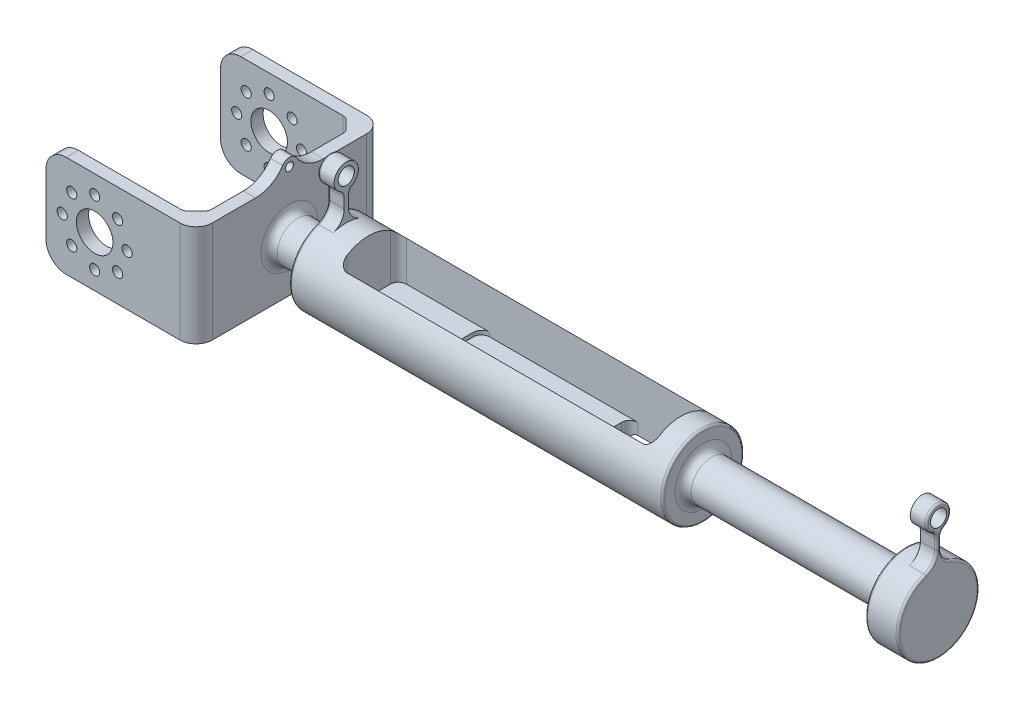
from build123d import *

# Parameters (mm, degrees)
SKETCH3_W                                           = 4
SKETCH3_H                                           = 1
BOSS_EXTRUDE1_DEPTH                                 = 75
BOSS_EXTRUDE1_DEPTH_BACK                            = 75
SKETCH2_R                                           = 10
SKETCH5_W                                           = 1
SKETCH5_H                                           = 9
EXTRUDE_THIN1_DEPTH                                 = 4
FILLET2_R                                           = 2
FILLET1_R                                           = 4
CUT_EXTRUDE1_DEPTH                                  = 80.082235679
CUT_EXTRUDE1_DEPTH_BACK                             = 4
SKETCH7_W                                           = 77
SKETCH7_H                                           = 14.7
SKETCH7_5_W                                         = 20
SKETCH7_5_H                                         = 14.7
CUT_EXTRUDE2_DEPTH                                  = 80.082235679
FILLET3_R                                           = 2
BOSS_EXTRUDE2_START                                 = -4
SKETCH7_4_W                                         = 20.5
SKETCH7_4_H                                         = 14.7
BOSS_EXTRUDE2_DEPTH                                 = 1
CBORE_FOR_00_BINDING_HEAD_MACHINE_SCREW_D           = 1.397
CBORE_FOR_00_BINDING_HEAD_MACHINE_SCREW_CBORE_D     = 3.175
CBORE_FOR_00_BINDING_HEAD_MACHINE_SCREW_CBORE_DEPTH = 2.711196
FILLET11_R                                          = 2
BOSS_EXTRUDE4_START                                 = -85
SKETCH2_2_R                                         = 5
BOSS_EXTRUDE4_DEPTH                                 = 10
SPLIT1_SURFACE_1_1_BACK                             = 165.587
SPLIT1_SURFACE_1_1_DEPTH                            = 331.174
SPLIT1_SURFACE_1_2_BACK                             = 165.587
SPLIT1_SURFACE_1_2_DEPTH                            = 331.174
SPLIT1_SURFACE_2_3_BACK                             = 165.587
SPLIT1_SURFACE_2_3_DEPTH                            = 331.174
SPLIT1_SURFACE_2_4_BACK                             = 165.587
SPLIT1_SURFACE_2_4_DEPTH                            = 331.174
MOVE_START                                          = 17
MOVE_FACE1_OUTLINE_R                                = 10
MOVE_FACE1_OUTLINE_R_2                              = 5
MOVE_FACE1_DEPTH                                    = 50
SHELL3_T                                            = -2
SKETCH12_W                                          = 40
SKETCH12_H                                          = 25
BOSS_EXTRUDE3_DEPTH                                 = 3
FILLET5_R                                           = 2
BOSS_EXTRUDE5_START                                 = -20
SKETCH14_W                                          = 37
SKETCH14_H                                          = 25
BOSS_EXTRUDE5_DEPTH                                 = 3
CUT_EXTRUDE3_DEPTH                                  = 127.261633127
CUT_EXTRUDE3_DEPTH_BACK                             = 127.261633127
SKETCH15_R                                          = 4.5
SKETCH15_R_2                                        = 1.25
FILLET6_R                                           = 4
CHAMFER1_SIZE                                       = 3
FILLET10_R                                          = 2
FILLET8_R                                           = 5
FILLET9_R                                           = 0.5
SKETCH17_W                                          = 3
SKETCH17_H                                          = 1
SKETCH18_W                                          = 2
SKETCH18_H                                          = 1.5
EXTRUDE_THIN2_DEPTH                                 = 3
FILLET12_R                                          = 8
FILLET13_R                                          = 8


# Read off the part's stored shape, not the designer's step: Move Face1
# Some blends are built 0.0001 mm under size
with BuildPart() as part:
    # Sketch3 → Revolve1 (revolve)
    with BuildSketch(Plane.XY, mode=Mode.PRIVATE) as revolve1_sk:
        with Locations((-73, 17.5)):
            Rectangle(SKETCH3_W, SKETCH3_H)
    revolve(revolve1_sk.sketch.rotate(Axis((-75, 20, 0), (1, 0, 0)), 270), axis=Axis((-75, 20, 0), (1, 0, 0)))

    # Sketch5 → Extrude-Thin1 (add)
    with BuildSketch(Plane(origin=(-75, 0, 75), x_dir=(0, 0, 1), z_dir=(-1, 0, 0))):
        with Locations((-75, 13.5)):
            Rectangle(SKETCH5_W, SKETCH5_H)
    extrude(amount=-EXTRUDE_THIN1_DEPTH)

    # Fillet2
    fillet2_edges = [part.edges().sort_by_distance(p)[0] for p in [
        (-73, 17.041960108, 0.5),
        (-73, 17.041960108, -0.5),
    ]]
    fillet(fillet2_edges, radius=FILLET2_R)


with BuildPart() as body_2:
    # Sketch2 → Boss-Extrude1 (new, two sides: drawn at the far end of the back side and taken through both)
    with BuildSketch(Plane(origin=(0, 0, 0), x_dir=(0, 0, -1), z_dir=(1, 0, 0)).offset(-BOSS_EXTRUDE1_DEPTH_BACK)):
        Circle(SKETCH2_R)
    extrude(amount=BOSS_EXTRUDE1_DEPTH + BOSS_EXTRUDE1_DEPTH_BACK)


with BuildPart() as body_3:
    # Mirror3: mirrored copy
    add(part.part.mirror(Plane(origin=(0, 0, 0), x_dir=(0, 0, 1), z_dir=(1, 0, 0))))


with BuildPart() as part_1:
    add(part.part)

    # Combine1: union body 3, body 2
    add(body_3.part)
    add(body_2.part)

    # Fillet1
    fillet1_edges = [part_1.edges().sort_by_distance(p)[0] for p in [
        (-73, 9.987492178, 0.5),
        (-73, 9.987492178, -0.5),
        (73, 9.987492178, -0.5),
        (73, 9.987492178, 0.5),
    ]]
    fillet(fillet1_edges, radius=FILLET1_R)

    # Sketch7 → Cut-Extrude1 (cut, two sides: drawn at the far end of the back side and taken through both)
    with BuildSketch(Plane(origin=(0, 0, 0), x_dir=(1, 0, 0), z_dir=(0, 1, 0)).offset(-CUT_EXTRUDE1_DEPTH_BACK)):
        with Locations((-27, 0)):
            Rectangle(SKETCH7_W, SKETCH7_H)
    extrude(amount=CUT_EXTRUDE1_DEPTH + CUT_EXTRUDE1_DEPTH_BACK, mode=Mode.SUBTRACT)

    # Sketch7<5> → Cut-Extrude2 (cut, through all)
    with BuildSketch(Plane(origin=(0, 0, 0), x_dir=(1, 0, 0), z_dir=(0, 1, 0))):
        with Locations((1.5, 0)):
            Rectangle(SKETCH7_5_W, SKETCH7_5_H)
    extrude(amount=-CUT_EXTRUDE2_DEPTH, mode=Mode.SUBTRACT)

    # Fillet3
    fillet3_edges = [part_1.edges().sort_by_distance(p)[0] for p in [
        (11.5, 0, 7.35),
        (-65.5, 1.390335529, 7.35),
        (-65.5, 1.390335529, -7.35),
        (11.5, 0, -7.35),
        (-8.5, -5.390335529, -7.35),
        (-8.5, -5.390335529, 7.35),
    ]]
    fillet(fillet3_edges, radius=FILLET3_R)

    # Sketch7<4> → Boss-Extrude2 (add)
    with BuildSketch(Plane(origin=(0, 0, 0), x_dir=(1, 0, 0), z_dir=(0, 1, 0)).offset(BOSS_EXTRUDE2_START)):
        with Locations((-55.25, 0)):
            Rectangle(SKETCH7_4_W, SKETCH7_4_H)
    extrude(amount=BOSS_EXTRUDE2_DEPTH)

    # CBORE for #00 Binding Head Machine Screw1 (through all)
    with Locations(Plane(origin=(0, -10, 0), x_dir=(-1, 0, 0), z_dir=(0, -1, 0))):
        with Locations((59, 0), (49, 0)):
            CounterBoreHole(CBORE_FOR_00_BINDING_HEAD_MACHINE_SCREW_D / 2, CBORE_FOR_00_BINDING_HEAD_MACHINE_SCREW_CBORE_D / 2, CBORE_FOR_00_BINDING_HEAD_MACHINE_SCREW_CBORE_DEPTH)

    # Fillet11
    fillet11_edges = [part_1.edges().sort_by_distance(p)[0] for p in [
        (-45, -3.5, -7.35),
        (-45, -3.5, 7.35),
    ]]
    fillet(fillet11_edges, radius=FILLET11_R)

    # Sketch2<2> → Boss-Extrude4 (add)
    with BuildSketch(Plane(origin=(0, 0, 0), x_dir=(0, 0, -1), z_dir=(1, 0, 0)).offset(BOSS_EXTRUDE4_START)):
        with Locations(Location((0, 0, 0), (0, 0, 180))):
            Circle(SKETCH2_2_R)
    extrude(amount=BOSS_EXTRUDE4_DEPTH)


with BuildPart() as body_2_2:
    # Split1: the piece behind the surface
    add(part_1.part)
    # Split1 surface 1: a surface, the sketch's curves swept straight by 331.174 mm
    with BuildLine(Plane.XY.offset(10).offset(-SPLIT1_SURFACE_1_1_BACK), mode=Mode.PRIVATE) as split1_surface_1_1_path:
        Line((17, -30), (17, 30))
    split1_surface_1_1 = Shell.extrude(split1_surface_1_1_path.wire(), (0 * SPLIT1_SURFACE_1_1_DEPTH, 0 * SPLIT1_SURFACE_1_1_DEPTH, 1 * SPLIT1_SURFACE_1_1_DEPTH))
    split(bisect_by=split1_surface_1_1, keep=Keep.BOTTOM)


with BuildPart() as part_2:
    add(part_1.part)

    # Split1: split by a surface, the side it looks to stays
    # Split1 surface 1: a surface, the sketch's curves swept straight by 331.174 mm
    with BuildLine(Plane.XY.offset(10).offset(-SPLIT1_SURFACE_1_2_BACK), mode=Mode.PRIVATE) as split1_surface_1_2_path:
        Line((17, -30), (17, 30))
    split1_surface_1_2 = Shell.extrude(split1_surface_1_2_path.wire(), (0 * SPLIT1_SURFACE_1_2_DEPTH, 0 * SPLIT1_SURFACE_1_2_DEPTH, 1 * SPLIT1_SURFACE_1_2_DEPTH))
    split(bisect_by=split1_surface_1_2, keep=Keep.TOP)


with BuildPart() as body_3_2:
    # Split1 2 body 2 2: the piece behind the surface
    add(body_2_2.part)
    # Split1 surface 2: a surface, the sketch's curves swept straight by 331.174 mm
    with BuildLine(Plane.XY.offset(10).offset(-SPLIT1_SURFACE_2_3_BACK), mode=Mode.PRIVATE) as split1_surface_2_3_path:
        Line((67, -30), (67, 30))
    split1_surface_2_3 = Shell.extrude(split1_surface_2_3_path.wire(), (0 * SPLIT1_SURFACE_2_3_DEPTH, 0 * SPLIT1_SURFACE_2_3_DEPTH, 1 * SPLIT1_SURFACE_2_3_DEPTH))
    split(bisect_by=split1_surface_2_3, keep=Keep.BOTTOM)


with BuildPart() as body_2_2_1:
    add(body_2_2.part)

    # Split1 2 body 2 2: split by a surface, the side it looks to stays
    # Split1 surface 2: a surface, the sketch's curves swept straight by 331.174 mm
    with BuildLine(Plane.XY.offset(10).offset(-SPLIT1_SURFACE_2_4_BACK), mode=Mode.PRIVATE) as split1_surface_2_4_path:
        Line((67, -30), (67, 30))
    split1_surface_2_4 = Shell.extrude(split1_surface_2_4_path.wire(), (0 * SPLIT1_SURFACE_2_4_DEPTH, 0 * SPLIT1_SURFACE_2_4_DEPTH, 1 * SPLIT1_SURFACE_2_4_DEPTH))
    split(bisect_by=split1_surface_2_4, keep=Keep.TOP)

    # Move Face1 outline → Move Face1 (cut)
    with BuildSketch(Plane.YZ.offset(MOVE_START)):
        Circle(MOVE_FACE1_OUTLINE_R)
        Circle(MOVE_FACE1_OUTLINE_R_2, mode=Mode.SUBTRACT)
    extrude(amount=MOVE_FACE1_DEPTH, mode=Mode.SUBTRACT)

    # Shell3
    shell3_openings = [body_2_2_1.faces().sort_by_distance(p)[0] for p in [
        (17, 0, 0),
        (67, 0, 0),
    ]]
    offset(amount=SHELL3_T, openings=shell3_openings, kind=Kind.INTERSECTION)


with BuildPart() as part_3:
    add(part_2.part)

    # Combine3: union body 2 2, body 3 2
    add(body_2_2_1.part)
    add(body_3_2.part)

    # Sketch12 → Boss-Extrude3 (add)
    with BuildSketch(Plane.ZY.offset(85)):
        Rectangle(SKETCH12_W, SKETCH12_H)
    extrude(amount=BOSS_EXTRUDE3_DEPTH)

    # Fillet5
    fillet5_edges = [part_3.edges().sort_by_distance(p)[0] for p in [
        (-75, 0, -5),
        (-85, 0, -5),
        (17, -5, 0),
        (67, -5, 0),
    ]]
    fillet(fillet5_edges, radius=FILLET5_R)


with BuildPart() as body_2_3:
    # Sketch14 → Boss-Extrude5 (new body)
    with BuildSketch(Plane.XY.offset(BOSS_EXTRUDE5_START)):
        with Locations((-103.5, 0)):
            Rectangle(SKETCH14_W, SKETCH14_H)
    extrude(amount=-BOSS_EXTRUDE5_DEPTH)


with BuildPart() as body_3_3:
    # Mirror8: mirrored copy
    add(body_2_3.part.mirror(Plane.XY))

    # Combine2: union part, body 2 3
    add(part_3.part)
    add(body_2_3.part)

    # Sketch15 → Cut-Extrude3 (cut, two sides: drawn at the far end of the back side and taken through both)
    with BuildSketch(Plane.XY.offset(-CUT_EXTRUDE3_DEPTH_BACK)):
        with Locations((-110, 0)):
            Circle(SKETCH15_R)
        with Locations((-118, 0)):
            Circle(SKETCH15_R_2)
        with Locations((-115.656854249, 5.656854249)):
            Circle(SKETCH15_R_2)
        with Locations((-110, 8)):
            Circle(SKETCH15_R_2)
        with Locations((-104.343145751, 5.656854249)):
            Circle(SKETCH15_R_2)
        with Locations((-102, 0)):
            Circle(SKETCH15_R_2)
        with Locations((-104.343145751, -5.656854249)):
            Circle(SKETCH15_R_2)
        with Locations((-110, -8)):
            Circle(SKETCH15_R_2)
        with Locations((-115.656854249, -5.656854249)):
            Circle(SKETCH15_R_2)
    extrude(amount=CUT_EXTRUDE3_DEPTH + CUT_EXTRUDE3_DEPTH_BACK, mode=Mode.SUBTRACT)

    # Fillet6
    fillet6_edges = [body_3_3.edges().sort_by_distance(p)[0] for p in [
        (-85, 0, -23),
        (-85, 0, 23),
    ]]
    fillet(fillet6_edges, radius=FILLET6_R)

    # Chamfer1
    chamfer1_edges = [body_3_3.edges().sort_by_distance(p)[0] for p in [
        (-88, 0, 20),
        (-88, 0, -20),
    ]]
    chamfer(chamfer1_edges, length=CHAMFER1_SIZE)

    # Fillet10
    fillet10_edges = [body_3_3.edges().sort_by_distance(p)[0] for p in [
        (-88, 0, -17),
        (-88, 0, 17),
        (-91, 0, 20),
        (-91, 0, -20),
    ]]
    fillet(fillet10_edges, radius=FILLET10_R)

    # Fillet8
    fillet8_edges = [body_3_3.edges().sort_by_distance(p)[0] for p in [
        (-122, 12.5, -21.5),
        (-122, -12.5, -21.5),
        (-122, -12.5, 21.5),
        (-122, 12.5, 21.5),
    ]]
    fillet(fillet8_edges, radius=FILLET8_R)

    # Fillet9
    fillet9_edges = [body_3_3.edges().sort_by_distance(p)[0] for p in [
        (17, 0, 10),
        (-75, -8.128433341, 5.824823725),
        (-75, 14.463473282, 0.5),
        (-75, 14.463473282, -0.5),
        (-75, 10.927144094, -1.248626664),
        (-75, 10.927144094, 1.248626664),
        (-75, 16.669872981, 0.767949192),
        (-75, 23, 0),
        (-75, 16.669872981, -0.767949192),
        (75, 16.669872981, -0.767949192),
        (75, 23, 0),
        (75, 16.669872981, 0.767949192),
        (75, 14.463473282, -0.5),
        (75, 14.463473282, 0.5),
        (75, 10.927144094, 1.248626664),
        (75, -8.128433341, 5.824823725),
        (75, 10.927144094, -1.248626664),
        (67, 0, 10),
    ]]
    fillet(fillet9_edges, radius=FILLET9_R)



with BuildPart() as body_2_4:
    # Sketch17 → Revolve2 (revolve)
    with BuildSketch(Plane.XY, mode=Mode.PRIVATE) as revolve2_sk:
        with Locations((-86.5, 13.5)):
            Rectangle(SKETCH17_W, SKETCH17_H)
    revolve(revolve2_sk.sketch.rotate(Axis((-86.869732406, 15, 0), (1, 0, 0)), 270), axis=Axis((-86.869732406, 15, 0), (1, 0, 0)))


with BuildPart() as body_3_3_1:
    add(body_3_3.part)

    add(body_2_4.part)  # Extrude-Thin2 merges body 2 4
    # Sketch18 → Extrude-Thin2 (add)
    with BuildSketch(Plane.ZY.offset(88)):
        with Locations((0, 13.25)):
            Rectangle(SKETCH18_W, SKETCH18_H)
    extrude(amount=-EXTRUDE_THIN2_DEPTH)

    # Fillet12
    # the kernel refuses this fillet: 8 mm, written as the material it adds along each edge
    with BuildSketch(Plane(origin=(-88, 12.5, -1), x_dir=(0, 0, -1), z_dir=(1, 0, 0))) as fillet12_piece_1:
        with BuildLine():
            CenterArc((3.420152207, 8), FILLET12_R, 244.68978598, 25.31021402)
            Line((0, 0.767949192), (-0.068403044, 0.623308176))
            ThreePointArc((-0.068403044, 0.623308176), (-0.16, 0.383974596), (-0.16, 0))
            Line((-0.16, 0), (0, -0.16))
            Line((0, -0.16), (3.420152207, -0.16))
            Line((3.420152207, -0.16), (3.420152207, 0))
        make_face()
    extrude(amount=3)
    with BuildSketch(Plane(origin=(-88, 12.5, 1), x_dir=(0, 1, 0), z_dir=(1, 0, 0))) as fillet12_piece_2:
        with BuildLine():
            CenterArc((8, 3.420152207), FILLET12_R, 180, 25.31021402)
            Line((0, 3.420152207), (-0.16, 3.420152207))
            Line((-0.16, 3.420152207), (-0.16, 0))
            Line((-0.16, 0), (0, -0.16))
            ThreePointArc((0, -0.16), (0.383974596, -0.16), (0.623308176, -0.068403044))
            Line((0.623308176, -0.068403044), (0.767949192, 0))
        make_face()
    extrude(amount=3)

    # Fillet13
    fillet13_edges = [body_3_3_1.edges().sort_by_distance(p)[0] for p in [
        (-86.5, 13.267949192, -1),
        (-86.5, 13.267949192, 1),
    ]]
    fillet(fillet13_edges, radius=FILLET13_R - 0.0001)  # a hair under: the kernel refuses the full size


solid = body_3_3_1.part
